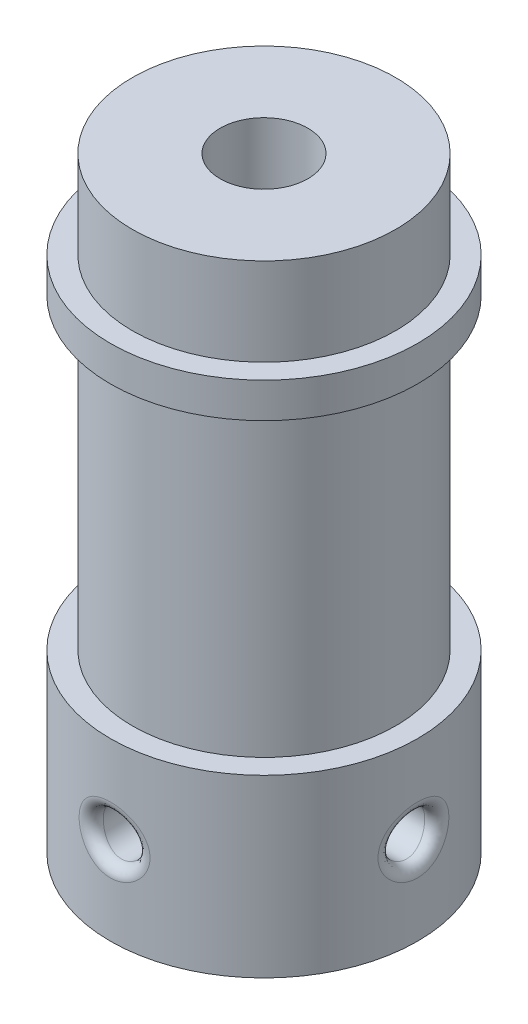
from build123d import *

# Parameters (mm, degrees)
SKETCH1_R           = 7
BOSS_EXTRUDE1_DEPTH = 8
SKETCH2_R           = 6
BOSS_EXTRUDE2_DEPTH = 14
SKETCH3_R           = 7
BOSS_EXTRUDE3_DEPTH = 1.6
SKETCH4_R           = 6
BOSS_EXTRUDE4_DEPTH = 4
SKETCH5_R           = 2
CUT_EXTRUDE1_DEPTH  = 30.321664346
SKETCH6_R           = 3
CUT_EXTRUDE2_DEPTH  = 20
CUT_EXTRUDE3_REACH  = 33.729
SKETCH8_R           = 1
CIRPATTERN1_COUNT   = 2
CIRPATTERN1_ANGLE   = 90
FILLET1_R           = 0.5


with BuildPart() as part:
    # Sketch1 → Boss-Extrude1 (new body)
    with BuildSketch(Plane(origin=(0, 0, 0), x_dir=(1, 0, 0), z_dir=(0, 1, 0))):
        Circle(SKETCH1_R)
    extrude(amount=BOSS_EXTRUDE1_DEPTH)

    # Sketch2 → Boss-Extrude2 (add)
    with BuildSketch(Plane(origin=(0, 8, 0), x_dir=(1, 0, 0), z_dir=(0, 1, 0))):
        Circle(SKETCH2_R)
    extrude(amount=BOSS_EXTRUDE2_DEPTH)

    # Sketch3 → Boss-Extrude3 (add)
    with BuildSketch(Plane(origin=(0, 22, 0), x_dir=(1, 0, 0), z_dir=(0, 1, 0))):
        Circle(SKETCH3_R)
    extrude(amount=BOSS_EXTRUDE3_DEPTH)

    # Sketch4 → Boss-Extrude4 (add)
    with BuildSketch(Plane(origin=(0, 23.6, 0), x_dir=(1, 0, 0), z_dir=(0, 1, 0))):
        Circle(SKETCH4_R)
    extrude(amount=BOSS_EXTRUDE4_DEPTH)

    # Sketch5 → Cut-Extrude1 (cut, through all)
    with BuildSketch(Plane(origin=(0, 27.6, 0), x_dir=(1, 0, 0), z_dir=(0, 1, 0))):
        Circle(SKETCH5_R)
    extrude(amount=-CUT_EXTRUDE1_DEPTH, mode=Mode.SUBTRACT)

    # Sketch6 → Cut-Extrude2 (cut)
    with BuildSketch(Plane.XZ):
        Circle(SKETCH6_R)
    extrude(amount=-CUT_EXTRUDE2_DEPTH, mode=Mode.SUBTRACT)

    # Sketch8 → Cut-Extrude3 (cut, up to next)
    with BuildSketch(Plane.XY.offset(7), mode=Mode.PRIVATE) as cut_extrude3_sk1:
        with Locations((0, 4)):
            Circle(SKETCH8_R)
    cut_extrude3_tool1 = extrude(cut_extrude3_sk1.sketch, amount=-CUT_EXTRUDE3_REACH, mode=Mode.PRIVATE) & part.part
    cut_extrude3 = cut_extrude3_tool1.solids().sort_by_distance((0, 4, 7))[0]
    add(cut_extrude3, mode=Mode.SUBTRACT)

    # CirPattern1: Cut-Extrude3 ×2 about axis
    cirpattern1_axis = Axis((0, 0, 0), (0, 1, 0))
    for i in range(1, CIRPATTERN1_COUNT):
        add(cut_extrude3.rotate(cirpattern1_axis, i * CIRPATTERN1_ANGLE / (CIRPATTERN1_COUNT - 1)), mode=Mode.SUBTRACT)

    # Fillet1
    fillet1_edges = [part.edges().sort_by_distance(p)[0] for p in [
        (6.92820323, 4, 1),
        (-1, 4, 6.92820323),
    ]]
    fillet(fillet1_edges, radius=FILLET1_R)


solid = part.part
